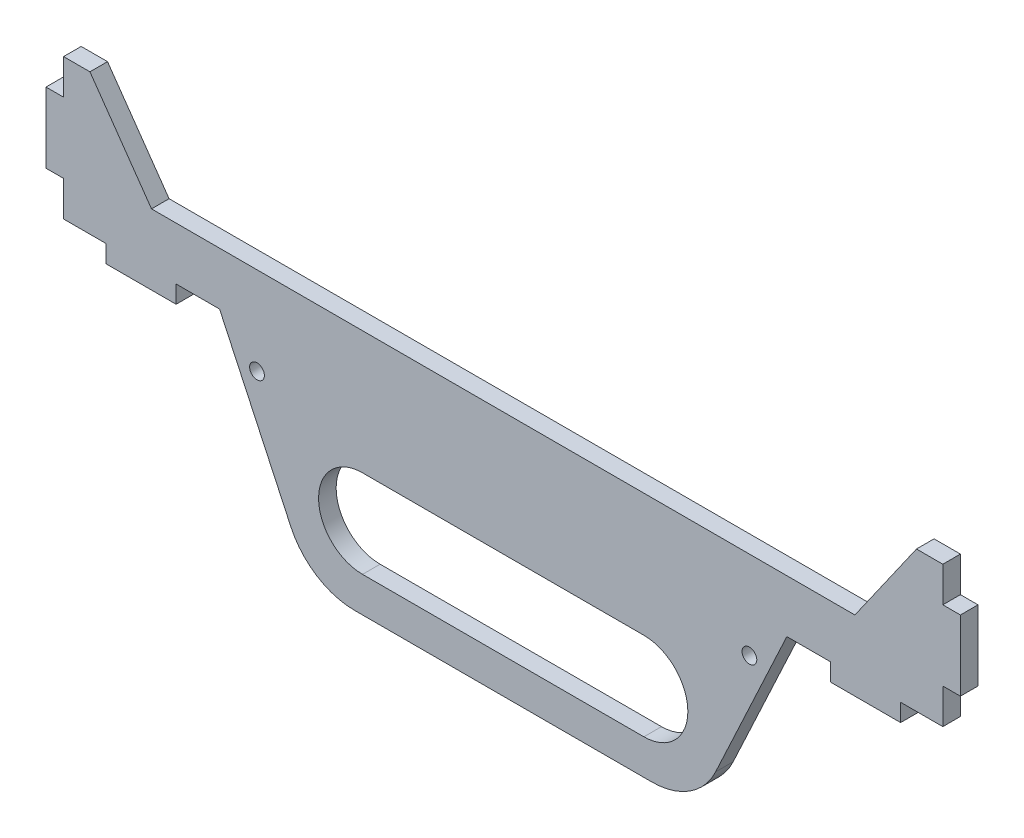
from build123d import *

# Parameters (mm, degrees)
BOSS_EXTRUDE1_DEPTH = 5
FILLET1_R           = 20
SKETCH3_R           = 2.1
CUT_EXTRUDE1_DEPTH  = 5


with BuildPart() as part:
    # Sketch1 → Boss-Extrude1 (new body)
    with BuildSketch(Plane.XY):
        Polygon((0, 0), (7.494811542, 0), (24.999999999, -25), (224.999999999, -25), (242.505188456, 0), (249.999999998, 0), (249.999999998, -10), (254.999999998, -10), (254.999999998, -30), (249.999999998, -30), (249.999999998, -40), (237.999999998, -40), (237.999999998, -45), (217.999999998, -45), (217.999999998, -40), (205.646921198, -40), (179.999999999, -95), (69.999999999, -95), (44.353078801, -40), (32, -40), (32, -45), (12, -45), (12, -40), (0, -40), (0, -30), (-5, -30), (-5, -10), (0, -10), align=None)
        with BuildLine():
            Line((84.999999999, -60), (164.999999999, -60))
            ThreePointArc((164.999999999, -60), (177.499999999, -72.5), (164.999999999, -85))
            Line((164.999999999, -85), (84.999999999, -85))
            ThreePointArc((84.999999999, -85), (72.499999999, -72.5), (84.999999999, -60))
        make_face(mode=Mode.SUBTRACT)
    extrude(amount=BOSS_EXTRUDE1_DEPTH)

    # Fillet1
    fillet1_edges = [part.edges().sort_by_distance(p)[0] for p in [
        (69.999999999, -95, 2.5),
        (179.999999999, -95, 2.5),
    ]]
    fillet(fillet1_edges, radius=FILLET1_R)

    # Sketch3 → Cut-Extrude1 (cut)
    with BuildSketch(Plane.XY.offset(5)):
        with Locations((55, -50)):
            Circle(SKETCH3_R)
    cut_extrude1 = extrude(amount=-CUT_EXTRUDE1_DEPTH, mode=Mode.SUBTRACT)

    # Mirror1: Cut-Extrude1 across plane
    add(cut_extrude1.mirror(Plane.ZY.offset(-124.999999999)), mode=Mode.SUBTRACT)


solid = part.part
